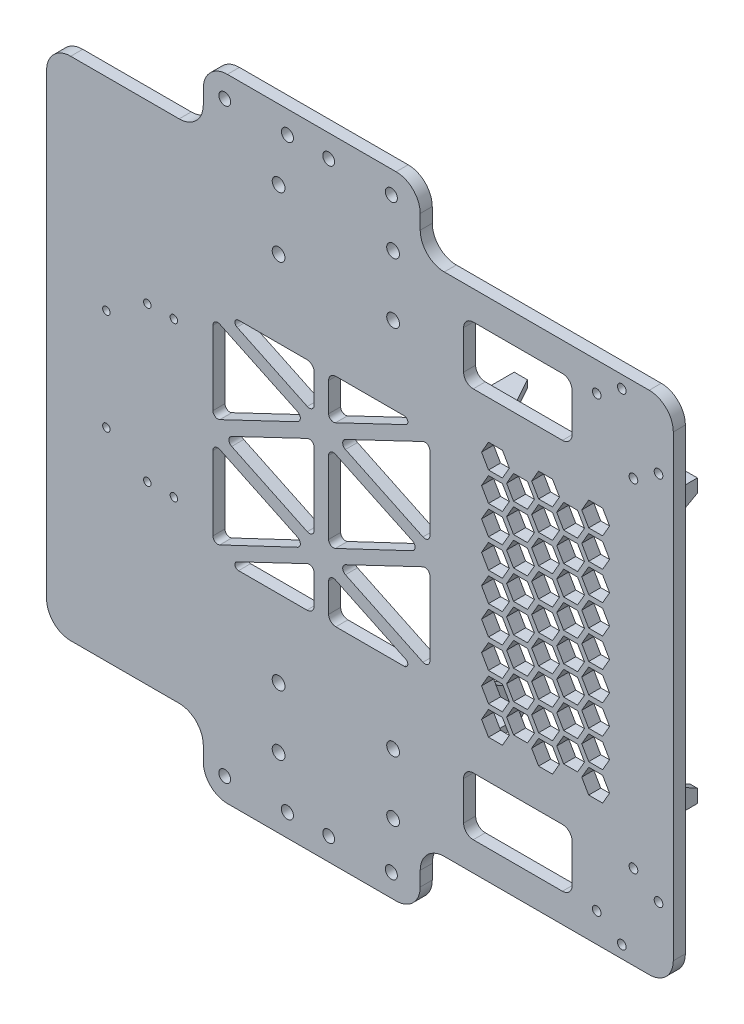
from build123d import *

# Parameters (mm, degrees)
EXTRUDE_1_DEPTH       = 5
EXTRUDE_2_DEPTH       = 20
CUT_EXTRUDE_3_DEPTH   = 10
CUT_EXTRUDE_4_DEPTH   = 10
MIRROR_2_COPY_1_DEPTH = 20
MIRROR_2_COPY_2_DEPTH = 10
MIRROR_2_COPY_3_DEPTH = 10
MIRROR_2_COPY_4_DEPTH = 20
MIRROR_2_COPY_5_DEPTH = 10
MIRROR_2_COPY_6_DEPTH = 10
CUT_EXTRUDE_5_DEPTH   = 5
SKETCH_9_W            = 45
SKETCH_9_H            = 24
CUT_EXTRUDE_6_DEPTH   = 5
FILLET_1_R            = 4
FILLET_2_R            = 1.5
FILLET_3_R            = 2
FILLET_4_R            = 3
SKETCH_10_R           = 1.8
SKETCH_10_R_2         = 1.55
SKETCH_10_R_3         = 2.65
SKETCH_10_R_4         = 2.5
SKETCH_10_R_5         = 2.45
CUT_EXTRUDE_7_DEPTH   = 186.636742053


with BuildPart() as part:
    # 草图1 → 凸台-拉伸1 (new body)
    with BuildSketch(Plane.XY):
        with BuildLine():
            Line((-130, 95), (-130, -95))
            ThreePointArc((-130, -95), (-127.071067812, -102.071067812), (-120, -105))
            Line((-120, -105), (-75, -105))
            ThreePointArc((-75, -105), (-67.928932188, -107.928932188), (-65, -115))
            Line((-65, -115), (-65, -121))
            ThreePointArc((-65, -121), (-62.071067812, -128.071067812), (-55, -131))
            Line((-55, -131), (15, -131))
            ThreePointArc((15, -131), (22.071067812, -128.071067812), (25, -121))
            Line((25, -121), (25, -115))
            ThreePointArc((25, -115), (27.928932188, -107.928932188), (35, -105))
            Line((35, -105), (120, -105))
            ThreePointArc((120, -105), (127.071067812, -102.071067812), (130, -95))
            Line((130, -95), (130, 95))
            ThreePointArc((130, 95), (127.071067812, 102.071067812), (120, 105))
            Line((120, 105), (35, 105))
            ThreePointArc((35, 105), (27.928932188, 107.928932188), (25, 115))
            Line((25, 115), (25, 121))
            ThreePointArc((25, 121), (22.071067812, 128.071067812), (15, 131))
            Line((15, 131), (-55, 131))
            ThreePointArc((-55, 131), (-62.071067812, 128.071067812), (-65, 121))
            Line((-65, 121), (-65, 115))
            ThreePointArc((-65, 115), (-67.928932188, 107.928932188), (-75, 105))
            Line((-75, 105), (-120, 105))
            ThreePointArc((-120, 105), (-127.071067812, 102.071067812), (-130, 95))
        make_face()
    extrude(amount=EXTRUDE_1_DEPTH)

    # 草图4 → 凸台-拉伸2 (add)
    with BuildSketch(Plane(origin=(0, 0, 0), x_dir=(-1, 0, 0), z_dir=(0, 0, -1))):
        Polygon((-39, -47.5), (-39, -58.5), (-50, -58.5), (-50, -55.5), (-42, -55.5), (-42, -47.5), align=None)
    extrude_2 = extrude(amount=EXTRUDE_2_DEPTH)

    # 草图5 → 切除-拉伸3 (cut)
    with BuildSketch(Plane.XZ.offset(58.5)):
        Polygon((50, -10), (44.5, -20), (50, -20), align=None)
    cut_extrude_3 = extrude(amount=-CUT_EXTRUDE_3_DEPTH, mode=Mode.SUBTRACT)

    # 草图6 → 切除-拉伸4 (cut)
    with BuildSketch(Plane.ZY.offset(-39)):
        Polygon((-20, -53), (-10, -47.5), (-20, -47.5), align=None)
    cut_extrude_4 = extrude(amount=-CUT_EXTRUDE_4_DEPTH, mode=Mode.SUBTRACT)

    # 镜向1: 凸台-拉伸2, 切除-拉伸3, 切除-拉伸4 across plane
    add(extrude_2.mirror(Plane(origin=(77, 0, 0), x_dir=(0, 0, 1), z_dir=(1, 0, 0))))
    add(cut_extrude_3.mirror(Plane(origin=(77, 0, 0), x_dir=(0, 0, 1), z_dir=(1, 0, 0))), mode=Mode.SUBTRACT)
    add(cut_extrude_4.mirror(Plane(origin=(77, 0, 0), x_dir=(0, 0, 1), z_dir=(1, 0, 0))), mode=Mode.SUBTRACT)

    # 镜向2 copy 1 sketch → 镜向2 copy 1 (add)
    with BuildSketch(Plane(origin=(154, 0, 0), x_dir=(1, 0, 0), z_dir=(0, 0, -1))):
        Polygon((-39, -47.5), (-39, -58.5), (-50, -58.5), (-50, -55.5), (-42, -55.5), (-42, -47.5), align=None)
    extrude(amount=MIRROR_2_COPY_1_DEPTH)

    # 镜向2 copy 2 sketch → 镜向2 copy 2 (cut)
    with BuildSketch(Plane(origin=(154, 58.5, 0), x_dir=(-1, 0, 0), z_dir=(0, 1, 0))):
        Polygon((50, -10), (44.5, -20), (50, -20), align=None)
    extrude(amount=-MIRROR_2_COPY_2_DEPTH, mode=Mode.SUBTRACT)

    # 镜向2 copy 3 sketch → 镜向2 copy 3 (cut)
    with BuildSketch(Plane(origin=(115, 0, 0), x_dir=(0, 0, 1), z_dir=(1, 0, 0))):
        Polygon((-20, -53), (-10, -47.5), (-20, -47.5), align=None)
    extrude(amount=-MIRROR_2_COPY_3_DEPTH, mode=Mode.SUBTRACT)

    # 镜向2 copy 4 sketch → 镜向2 copy 4 (add)
    with BuildSketch(Plane(origin=(0, 0, 0), x_dir=(-1, 0, 0), z_dir=(0, 0, -1))):
        Polygon((-39, 47.5), (-39, 58.5), (-50, 58.5), (-50, 55.5), (-42, 55.5), (-42, 47.5), align=None)
    extrude(amount=MIRROR_2_COPY_4_DEPTH)

    # 镜向2 copy 5 sketch → 镜向2 copy 5 (cut)
    with BuildSketch(Plane(origin=(0, 58.5, 0), x_dir=(1, 0, 0), z_dir=(0, 1, 0))):
        Polygon((50, 10), (44.5, 20), (50, 20), align=None)
    extrude(amount=-MIRROR_2_COPY_5_DEPTH, mode=Mode.SUBTRACT)

    # 镜向2 copy 6 sketch → 镜向2 copy 6 (cut)
    with BuildSketch(Plane.ZY.offset(-39)):
        Polygon((-20, 53), (-10, 47.5), (-20, 47.5), align=None)
    extrude(amount=-MIRROR_2_COPY_6_DEPTH, mode=Mode.SUBTRACT)

    # 草图7 → 切除-拉伸5 (cut)
    with BuildSketch(Plane(origin=(0, 0, 0), x_dir=(-1, 0, 0), z_dir=(0, 0, -1))):
        Polygon((-92.012994616, 36), (-94.899745962, 41), (-100.673248654, 41), (-103.56, 36), (-100.673248654, 31), (-94.899745962, 31), align=None)
        Polygon((-74.115136271, 31), (-71.228384925, 36), (-74.115136271, 41), (-79.888638963, 41), (-82.775390309, 36), (-79.888638963, 31), align=None)
        Polygon((-92.012994616, 24), (-94.899745962, 29), (-100.673248654, 29), (-103.56, 24), (-100.673248654, 19), (-94.899745962, 19), align=None)
        Polygon((-93.167695155, 30), (-90.280943809, 25), (-84.507441117, 25), (-81.620689771, 30), (-84.507441117, 35), (-90.280943809, 35), align=None)
        Polygon((-84.507441117, 37), (-81.620689771, 42), (-84.507441117, 47), (-90.280943809, 47), (-93.167695155, 42), (-90.280943809, 37), align=None)
        Polygon((-79.888638963, 43), (-74.115136271, 43), (-71.228384925, 48), (-74.115136271, 53), (-79.888638963, 53), (-82.775390309, 48), align=None)
        Polygon((-94.899745962, 43), (-92.012994616, 48), (-94.899745962, 53), (-100.673248654, 53), (-103.56, 48), (-100.673248654, 43), align=None)
        Polygon((-72.383085464, 42), (-69.496334118, 37), (-63.722831426, 37), (-60.83608008, 42), (-63.722831426, 47), (-69.496334118, 47), align=None)
        Polygon((-93.167695155, 18), (-90.280943809, 13), (-84.507441117, 13), (-81.620689771, 18), (-84.507441117, 23), (-90.280943809, 23), align=None)
        Polygon((-74.115136271, 19), (-71.228384925, 24), (-74.115136271, 29), (-79.888638963, 29), (-82.775390309, 24), (-79.888638963, 19), align=None)
        Polygon((-72.383085464, 30), (-69.496334118, 25), (-63.722831426, 25), (-60.83608008, 30), (-63.722831426, 35), (-69.496334118, 35), align=None)
        Polygon((-92.012994616, 12), (-94.899745962, 17), (-100.673248654, 17), (-103.56, 12), (-100.673248654, 7), (-94.899745962, 7), align=None)
        Polygon((-93.167695155, 6), (-90.280943809, 1), (-84.507441117, 1), (-81.620689771, 6), (-84.507441117, 11), (-90.280943809, 11), align=None)
        Polygon((-74.115136271, 7), (-71.228384925, 12), (-74.115136271, 17), (-79.888638963, 17), (-82.775390309, 12), (-79.888638963, 7), align=None)
        Polygon((-72.383085464, 18), (-69.496334118, 13), (-63.722831426, 13), (-60.83608008, 18), (-63.722831426, 23), (-69.496334118, 23), align=None)
        Polygon((-92.012994616, 0), (-94.899745962, 5), (-100.673248654, 5), (-103.56, 0), (-100.673248654, -5), (-94.899745962, -5), align=None)
        Polygon((-93.167695155, -6), (-90.280943809, -11), (-84.507441117, -11), (-81.620689771, -6), (-84.507441117, -1), (-90.280943809, -1), align=None)
        Polygon((-74.115136271, -5), (-71.228384925, 0), (-74.115136271, 5), (-79.888638963, 5), (-82.775390309, 0), (-79.888638963, -5), align=None)
        Polygon((-72.383085464, 6), (-69.496334118, 1), (-63.722831426, 1), (-60.83608008, 6), (-63.722831426, 11), (-69.496334118, 11), align=None)
        Polygon((-92.012994616, -12), (-94.899745962, -7), (-100.673248654, -7), (-103.56, -12), (-100.673248654, -17), (-94.899745962, -17), align=None)
        Polygon((-93.167695155, -18), (-90.280943809, -23), (-84.507441117, -23), (-81.620689771, -18), (-84.507441117, -13), (-90.280943809, -13), align=None)
        Polygon((-74.115136271, -17), (-71.228384925, -12), (-74.115136271, -7), (-79.888638963, -7), (-82.775390309, -12), (-79.888638963, -17), align=None)
        Polygon((-72.383085464, -6), (-69.496334118, -11), (-63.722831426, -11), (-60.83608008, -6), (-63.722831426, -1), (-69.496334118, -1), align=None)
        Polygon((-92.012994616, -24), (-94.899745962, -19), (-100.673248654, -19), (-103.56, -24), (-100.673248654, -29), (-94.899745962, -29), align=None)
        Polygon((-93.167695155, -30), (-90.280943809, -35), (-84.507441117, -35), (-81.620689771, -30), (-84.507441117, -25), (-90.280943809, -25), align=None)
        Polygon((-74.115136271, -29), (-71.228384925, -24), (-74.115136271, -19), (-79.888638963, -19), (-82.775390309, -24), (-79.888638963, -29), align=None)
        Polygon((-72.383085464, -18), (-69.496334118, -23), (-63.722831426, -23), (-60.83608008, -18), (-63.722831426, -13), (-69.496334118, -13), align=None)
        Polygon((-92.012994616, -36), (-94.899745962, -31), (-100.673248654, -31), (-103.56, -36), (-100.673248654, -41), (-94.899745962, -41), align=None)
        Polygon((-93.167695155, -42), (-90.280943809, -47), (-84.507441117, -47), (-81.620689771, -42), (-84.507441117, -37), (-90.280943809, -37), align=None)
        Polygon((-74.115136271, -41), (-71.228384925, -36), (-74.115136271, -31), (-79.888638963, -31), (-82.775390309, -36), (-79.888638963, -41), align=None)
        Polygon((-72.383085464, -30), (-69.496334118, -35), (-63.722831426, -35), (-60.83608008, -30), (-63.722831426, -25), (-69.496334118, -25), align=None)
        Polygon((-92.012994616, -48), (-94.899745962, -43), (-100.673248654, -43), (-103.56, -48), (-100.673248654, -53), (-94.899745962, -53), align=None)
        Polygon((-74.115136271, -53), (-71.228384925, -48), (-74.115136271, -43), (-79.888638963, -43), (-82.775390309, -48), (-79.888638963, -53), align=None)
        Polygon((-72.383085464, -42), (-69.496334118, -47), (-63.722831426, -47), (-60.83608008, -42), (-63.722831426, -37), (-69.496334118, -37), align=None)
        Polygon((-61.990780618, 36), (-59.104029272, 31), (-53.330526581, 31), (-50.443775235, 36), (-53.330526581, 41), (-59.104029272, 41), align=None)
        Polygon((-61.990780618, 48), (-59.104029272, 43), (-53.330526581, 43), (-50.443775235, 48), (-53.330526581, 53), (-59.104029272, 53), align=None)
        Polygon((-61.990780618, 24), (-59.104029272, 19), (-53.330526581, 19), (-50.443775235, 24), (-53.330526581, 29), (-59.104029272, 29), align=None)
        Polygon((-61.990780618, 12), (-59.104029272, 7), (-53.330526581, 7), (-50.443775235, 12), (-53.330526581, 17), (-59.104029272, 17), align=None)
        Polygon((-61.990780618, 0), (-59.104029272, -5), (-53.330526581, -5), (-50.443775235, 0), (-53.330526581, 5), (-59.104029272, 5), align=None)
        Polygon((-61.990780618, -12), (-59.104029272, -17), (-53.330526581, -17), (-50.443775235, -12), (-53.330526581, -7), (-59.104029272, -7), align=None)
        Polygon((-61.990780618, -24), (-59.104029272, -29), (-53.330526581, -29), (-50.443775235, -24), (-53.330526581, -19), (-59.104029272, -19), align=None)
        Polygon((-61.990780618, -36), (-59.104029272, -41), (-53.330526581, -41), (-50.443775235, -36), (-53.330526581, -31), (-59.104029272, -31), align=None)
        Polygon((-61.990780618, -48), (-59.104029272, -53), (-53.330526581, -53), (-50.443775235, -48), (-53.330526581, -43), (-59.104029272, -43), align=None)
    extrude(amount=-CUT_EXTRUDE_5_DEPTH, mode=Mode.SUBTRACT)

    # 草图9 → 切除-拉伸6 (cut)
    with BuildSketch(Plane(origin=(0, 0, 0), x_dir=(-1, 0, 0), z_dir=(0, 0, -1))):
        Polygon((9.804878049, 22.5), (-29, 41), (-29, 4), align=None)
        Polygon((13, -26.88372093), (-25, -45), (13, -45), align=None)
        Polygon((22.074593576, -22.557461202), (61, -41), (61, -4), align=None)
        Polygon((19, 26.88372093), (57, 45), (19, 45), align=None)
        Polygon((19, -18.11627907), (57, 0), (19, 18.11627907), align=None)
        with Locations((-65.5, 81)):
            Rectangle(SKETCH_9_W, SKETCH_9_H)
        with Locations((-65.5, -81)):
            Rectangle(SKETCH_9_W, SKETCH_9_H)
        Polygon((13, 45), (-25, 45), (13, 26.88372093), align=None)
        Polygon((61, 4), (61, 41), (22.074593576, 22.557461202), align=None)
        Polygon((13, 18.257993079), (-25.535898385, 0), (13, -18.257993079), align=None)
        Polygon((19, -45), (57, -45), (19, -26.88372093), align=None)
        Polygon((-29, -41), (9.804878049, -22.5), (-29, -4), align=None)
    extrude(amount=-CUT_EXTRUDE_6_DEPTH, mode=Mode.SUBTRACT)

    # 圆角1
    fillet_1_edges = [part.edges().sort_by_distance(p)[0] for p in [
        (43, -93, 2.5),
        (88, -69, 2.5),
        (43, -69, 2.5),
        (88, -93, 2.5),
        (88, 69, 2.5),
        (43, 69, 2.5),
        (43, 93, 2.5),
        (88, 93, 2.5),
    ]]
    fillet(fillet_1_edges, radius=FILLET_1_R)

    # 圆角2
    fillet_2_edges = [part.edges().sort_by_distance(p)[0] for p in [
        (25, -45, 2.5),
        (-57, -45, 2.5),
        (25, 45, 2.5),
        (-57, 45, 2.5),
    ]]
    fillet(fillet_2_edges, radius=FILLET_2_R)

    # 圆角3
    fillet_3_edges = [part.edges().sort_by_distance(p)[0] for p in [
        (29, -4, 2.5),
        (29, 4, 2.5),
        (-13, -18.257993079, 2.5),
        (-61, -41, 2.5),
        (-61, 4, 2.5),
        (-13, -26.88372093, 2.5),
        (-13, 18.257993079, 2.5),
        (-61, -4, 2.5),
        (-22.074593576, -22.557461202, 2.5),
        (25.535898385, 0, 2.5),
        (-22.074593576, 22.557461202, 2.5),
        (-61, 41, 2.5),
        (-19, 26.88372093, 2.5),
        (-19, -26.88372093, 2.5),
        (-19, -18.11627907, 2.5),
        (29, -41, 2.5),
        (29, 41, 2.5),
        (-57, 0, 2.5),
        (-9.804878049, -22.5, 2.5),
        (-13, 26.88372093, 2.5),
        (-9.804878049, 22.5, 2.5),
        (-19, 18.11627907, 2.5),
    ]]
    fillet(fillet_3_edges, radius=FILLET_3_R)

    # 圆角4
    fillet_4_edges = [part.edges().sort_by_distance(p)[0] for p in [
        (-13, -45, 2.5),
        (-13, 45, 2.5),
        (-19, -45, 2.5),
        (-19, 45, 2.5),
    ]]
    fillet(fillet_4_edges, radius=FILLET_4_R)

    # 草图10 → 切除-拉伸7 (cut, through all)
    with BuildSketch(Plane(origin=(0, 0, 0), x_dir=(-1, 0, 0), z_dir=(0, 0, -1))):
        with Locations((-123.874270778, 76.959685144)):
            Circle(SKETCH_10_R)
        with Locations((-113.46869275, 70.033362462)):
            Circle(SKETCH_10_R)
        with Locations((-108.636360878, 99.851956806)):
            Circle(SKETCH_10_R)
        with Locations((-98.23078285, 92.925634125)):
            Circle(SKETCH_10_R)
        with Locations((105.210066138, 21)):
            Circle(SKETCH_10_R_2)
        with Locations((88.210066138, 32)):
            Circle(SKETCH_10_R_2)
        with Locations((77.210066138, 32)):
            Circle(SKETCH_10_R_2)
        with Locations((33.75, 102)):
            Circle(SKETCH_10_R_3)
        with Locations((33.75, 77)):
            Circle(SKETCH_10_R_3)
        with Locations((-13.75, 77)):
            Circle(SKETCH_10_R_3)
        with Locations((-13.75, 102)):
            Circle(SKETCH_10_R_3)
        with Locations((-13.026746603, 121.678975654)):
            Circle(SKETCH_10_R_4)
        with Locations((56.094087389, 121.678975654)):
            Circle(SKETCH_10_R_5)
        with Locations((30.094087389, 121.678975654)):
            Circle(SKETCH_10_R_4)
        with Locations((12.973253397, 121.678975654)):
            Circle(SKETCH_10_R_5)
        with Locations((12.973253397, -121.678975654)):
            Circle(SKETCH_10_R_5)
        with Locations((30.094087389, -121.678975654)):
            Circle(SKETCH_10_R_4)
        with Locations((56.094087389, -121.678975654)):
            Circle(SKETCH_10_R_5)
        with Locations((-13.026746603, -121.678975654)):
            Circle(SKETCH_10_R_4)
        with Locations((-13.75, -102)):
            Circle(SKETCH_10_R_3)
        with Locations((-13.75, -77)):
            Circle(SKETCH_10_R_3)
        with Locations((33.75, -77)):
            Circle(SKETCH_10_R_3)
        with Locations((33.75, -102)):
            Circle(SKETCH_10_R_3)
        with Locations((77.210066138, -32)):
            Circle(SKETCH_10_R_2)
        with Locations((88.210066138, -32)):
            Circle(SKETCH_10_R_2)
        with Locations((105.210066138, -21)):
            Circle(SKETCH_10_R_2)
        with Locations((-98.23078285, -92.925634125)):
            Circle(SKETCH_10_R)
        with Locations((-108.636360878, -99.851956806)):
            Circle(SKETCH_10_R)
        with Locations((-113.46869275, -70.033362462)):
            Circle(SKETCH_10_R)
        with Locations((-123.874270778, -76.959685144)):
            Circle(SKETCH_10_R)
    extrude(amount=-CUT_EXTRUDE_7_DEPTH, mode=Mode.SUBTRACT)


solid = part.part
